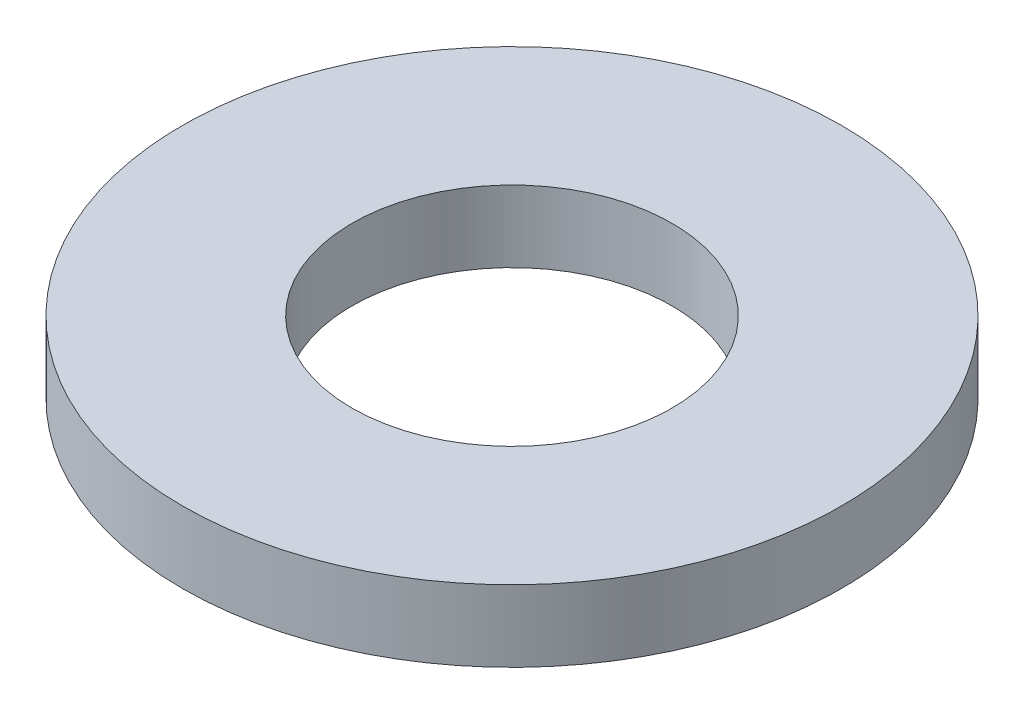
from build123d import *

# Parameters (mm, degrees)
SKETCH1_R           = 87.5
BOSS_EXTRUDE1_DEPTH = 19
SKETCH2_R           = 42.5
CUT_EXTRUDE1_DEPTH  = 126.193849689


with BuildPart() as part:
    # Sketch1 → Boss-Extrude1 (new body)
    with BuildSketch(Plane(origin=(0, 0, 0), x_dir=(1, 0, 0), z_dir=(0, 1, 0))):
        Circle(SKETCH1_R)
    extrude(amount=BOSS_EXTRUDE1_DEPTH)

    # Sketch2 → Cut-Extrude1 (cut, through all)
    with BuildSketch(Plane(origin=(0, 0, 0), x_dir=(1, 0, 0), z_dir=(0, 1, 0))):
        Circle(SKETCH2_R)
    extrude(amount=CUT_EXTRUDE1_DEPTH, mode=Mode.SUBTRACT)


solid = part.part
